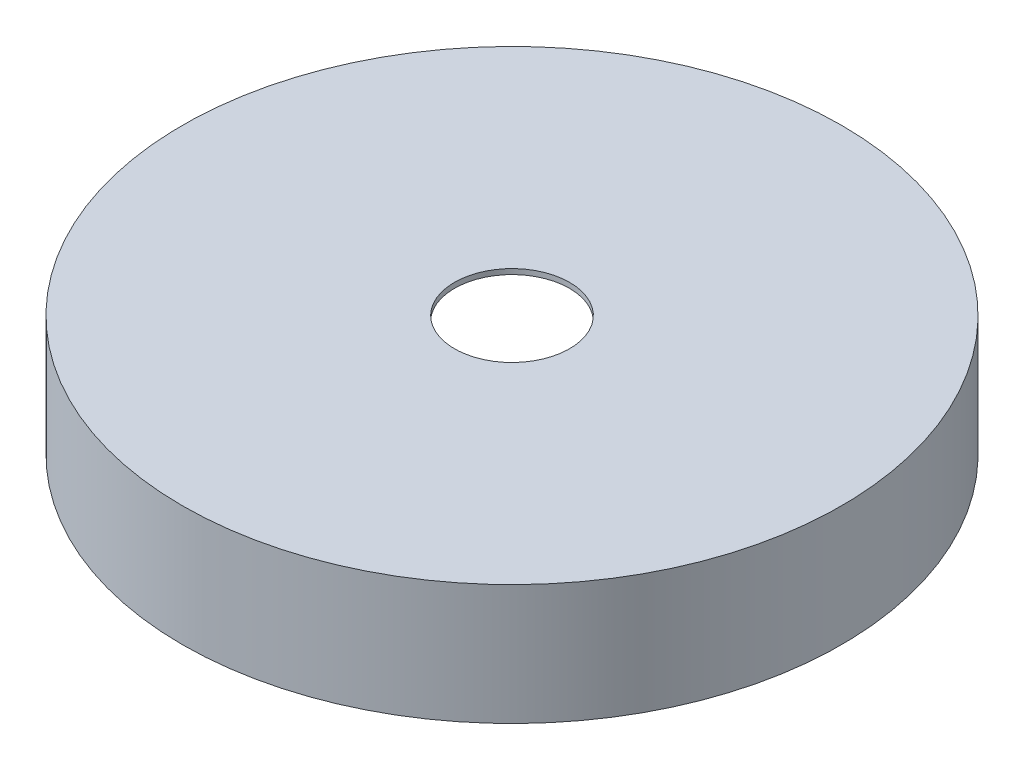
from build123d import *


with BuildPart() as part:
    # Sketch1 → Revolve1 (revolve)
    with BuildSketch(Plane.XY):
        Polygon((-160.02, 0), (-160.02, 58.42), (-27.94, 58.42), (-27.94, 55.88), (-157.48, 55.88), (-157.48, 0), align=None)
    revolve(axis=Axis((0, -2.54, 0), (0, 1, 0)))


solid = part.part
